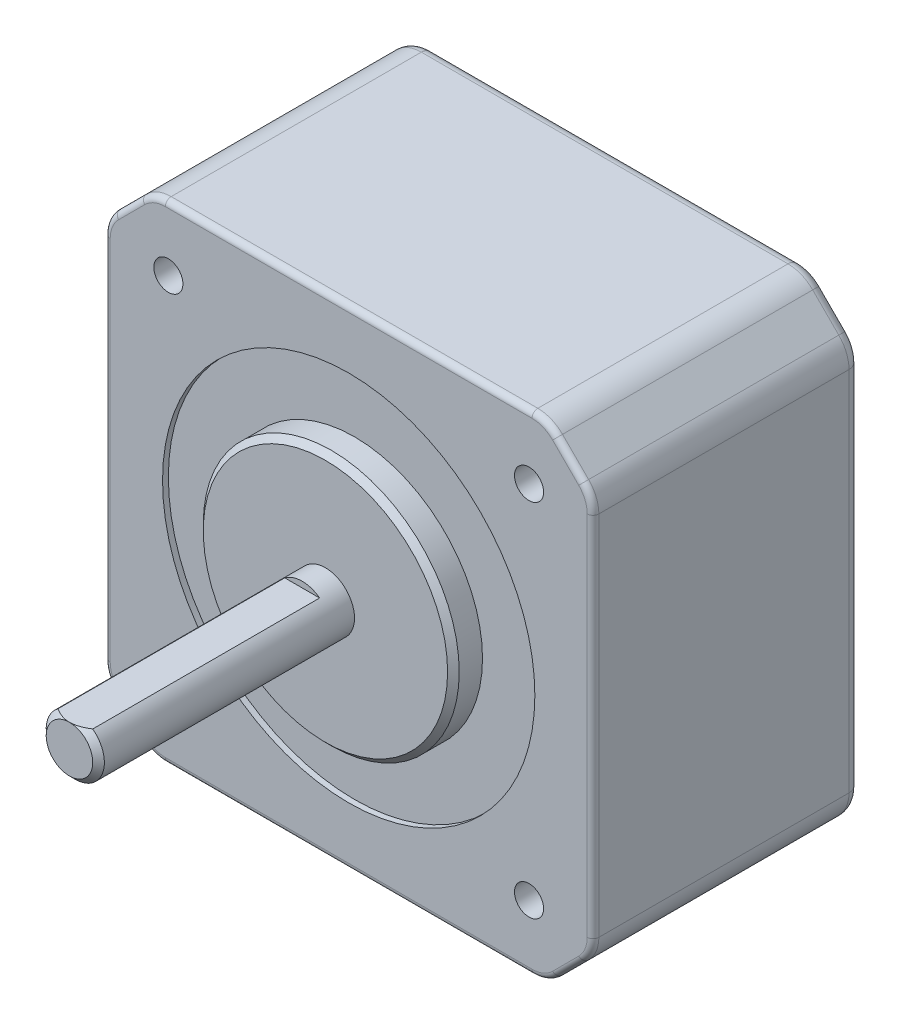
from build123d import *

# Parameters (mm, degrees)
SKETCH1_W           = 42
SKETCH1_H           = 42
BOSS_EXTRUDE1_DEPTH = 11.5
CHAMFER1_SIZE       = 4
SKETCH2_R           = 11
BOSS_EXTRUDE2_DEPTH = 2
CUT_EXTRUDE1_START  = -0.5
SKETCH3_R           = 16
SKETCH3_R_2         = 11
CUT_EXTRUDE1_DEPTH  = 0.5
SKETCH4_R           = 2.5
BOSS_EXTRUDE3_DEPTH = 22
SKETCH5_W           = 10.364275964
SKETCH5_H           = 1.526028363
CUT_EXTRUDE2_DEPTH  = 20
CIRPATTERN1_COUNT   = 4
FILLET1_R           = 3
CHAMFER2_SIZE       = 0.5
FILLET2_R           = 1
FILLET3_R           = 0.5
SKETCH9_R           = 3.5
CUT_EXTRUDE3_DEPTH  = 3.5


with BuildPart() as part:
    # Sketch1 → Boss-Extrude1 (new, symmetric)
    with BuildSketch(Plane.XY):
        Rectangle(SKETCH1_W, SKETCH1_H)
    extrude(amount=BOSS_EXTRUDE1_DEPTH, both=True)

    # Chamfer1
    chamfer1_edges = [part.edges().sort_by_distance(p)[0] for p in [
        (21, -21, 0),
        (-21, -21, 0),
        (-21, 21, 0),
        (21, 21, 0),
    ]]
    chamfer(chamfer1_edges, length=CHAMFER1_SIZE)

    # Sketch2 → Boss-Extrude2 (add)
    with BuildSketch(Plane.XY.offset(11.5)):
        with Locations(Location((0, 0, 0), (0, 0, 180))):
            Circle(SKETCH2_R)
    extrude(amount=BOSS_EXTRUDE2_DEPTH)

    # Sketch3 → Cut-Extrude1 (cut)
    with BuildSketch(Plane.XY.offset(11.5).offset(CUT_EXTRUDE1_START)):
        Circle(SKETCH3_R)
        Circle(SKETCH3_R_2, mode=Mode.SUBTRACT)
    extrude(amount=CUT_EXTRUDE1_DEPTH, mode=Mode.SUBTRACT)

    # Sketch4 → Boss-Extrude3 (add)
    with BuildSketch(Plane.XY.offset(13.5)):
        Circle(SKETCH4_R)
    extrude(amount=BOSS_EXTRUDE3_DEPTH)

    # Sketch5 → Cut-Extrude2 (cut)
    with BuildSketch(Plane.XY.offset(35.5)):
        with Locations((0.738499094, 2.763014181)):
            Rectangle(SKETCH5_W, SKETCH5_H)
    extrude(amount=-CUT_EXTRUDE2_DEPTH, mode=Mode.SUBTRACT)

    # Sketch7 → M3x0.5 Tapped Hole1 (revolve, cut)
    with BuildSketch(Plane(origin=(-15.5, 15.5, 11.5), x_dir=(0, -1, 0), z_dir=(1, 0, 0))):
        Polygon((0, 0), (0, 8.251075774), (1.25, 7.5), (1.25, 0), align=None)
    m3x0_5_tapped_hole1 = revolve(axis=Axis((-15.5, 15.5, 17.85), (0, 0, -1)), mode=Mode.SUBTRACT)

    # CirPattern1: M3x0.5 Tapped Hole1 ×4 about axis
    cirpattern1_axis = Axis((0, 0, 0), (0, 0, 1))
    for i in range(1, CIRPATTERN1_COUNT):
        add(m3x0_5_tapped_hole1.rotate(cirpattern1_axis, i * 360 / CIRPATTERN1_COUNT), mode=Mode.SUBTRACT)

    # Fillet1
    fillet1_edges = [part.edges().sort_by_distance(p)[0] for p in [
        (17, -21, 0),
        (-17, -21, 0),
        (-21, 17, 0),
        (-21, -17, 0),
        (21, 17, 0),
        (21, -17, 0),
        (17, 21, 0),
        (-17, 21, 0),
    ]]
    fillet(fillet1_edges, radius=FILLET1_R)

    # Chamfer2
    chamfer2_edges = [part.edges().sort_by_distance(p)[0] for p in [
        (-1.118033989, -2.236067977, 35.5),
        (11, 0, 13.5),
    ]]
    chamfer(chamfer2_edges, length=CHAMFER2_SIZE - 0.0001)  # a hair under: the kernel refuses the full size

    # Fillet2
    fillet2_edges = [part.edges().sort_by_distance(p)[0] for p in [
        (-19, -19, -11.5),
        (0, -21, -11.5),
        (-19, 19, -11.5),
        (0, 21, -11.5),
        (19, 19, -11.5),
        (21, 0, -11.5),
        (19, -19, -11.5),
        (-16.90540961, 20.771638598, -11.5),
        (-20.771638598, 16.90540961, -11.5),
        (16.90540961, 20.771638598, -11.5),
        (20.771638598, 16.90540961, -11.5),
        (20.771638598, -16.90540961, -11.5),
        (16.90540961, -20.771638598, -11.5),
        (-16.90540961, -20.771638598, -11.5),
        (-20.771638598, -16.90540961, -11.5),
        (-21, 0, -11.5),
    ]]
    fillet(fillet2_edges, radius=FILLET2_R)

    # Fillet3
    fillet3_edges = [part.edges().sort_by_distance(p)[0] for p in [
        (-20.771638598, 16.90540961, 11.5),
        (16.90540961, 20.771638598, 11.5),
        (20.771638598, 16.90540961, 11.5),
        (20.771638598, -16.90540961, 11.5),
        (16.90540961, -20.771638598, 11.5),
        (-16.90540961, -20.771638598, 11.5),
        (-20.771638598, -16.90540961, 11.5),
        (-21, 0, 11.5),
        (-19, -19, 11.5),
        (0, -21, 11.5),
        (19, -19, 11.5),
        (21, 0, 11.5),
        (19, 19, 11.5),
        (0, 21, 11.5),
        (-19, 19, 11.5),
        (-16.90540961, 20.771638598, 11.5),
    ]]
    fillet(fillet3_edges, radius=FILLET3_R)

    # Sketch9 → Cut-Extrude3 (cut)
    with BuildSketch(Plane(origin=(0, 0, -11.5), x_dir=(-1, 0, 0), z_dir=(0, 0, -1))):
        Circle(SKETCH9_R)
    extrude(amount=-CUT_EXTRUDE3_DEPTH, mode=Mode.SUBTRACT)


solid = part.part
